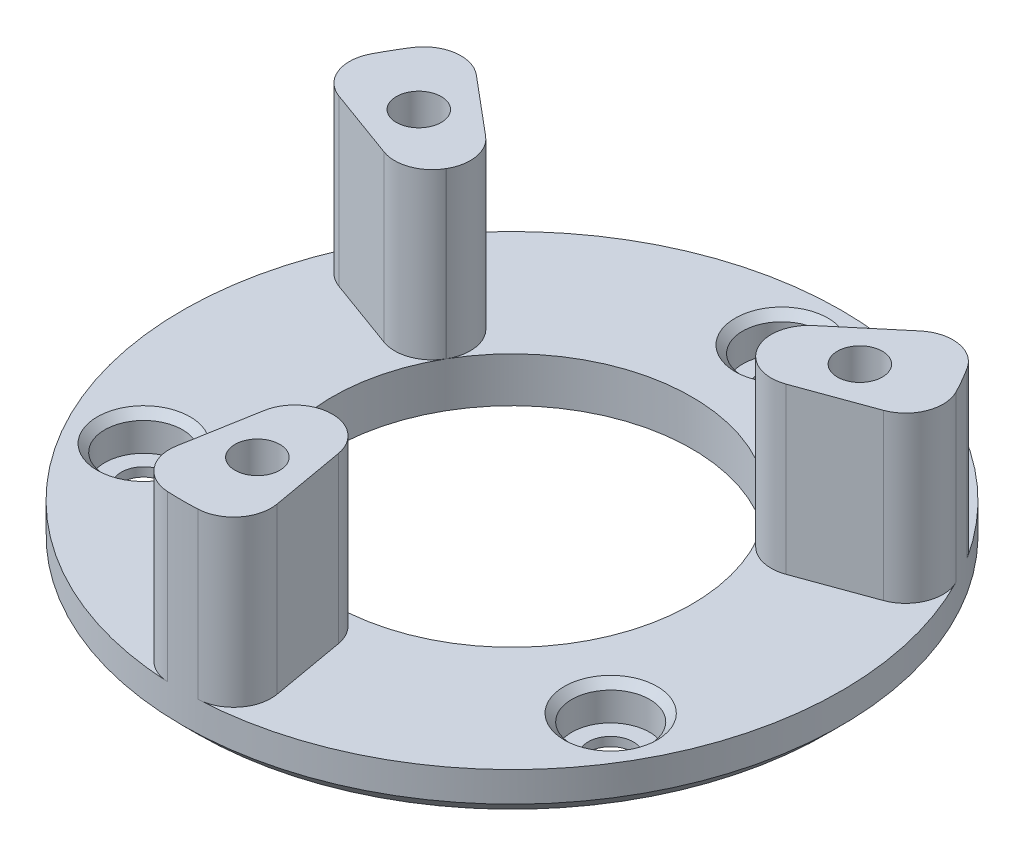
from build123d import *
from build123d.topology import SkipClean

# Parameters (mm, degrees)
SKETCH1_R           = 22
SKETCH1_R_2         = 12
BOSS_EXTRUDE1_DEPTH = 3
SKETCH3_R           = 1.5
CUT_EXTRUDE2_DEPTH  = 32.256999216
SKETCH5_R           = 2.6
CUT_EXTRUDE3_DEPTH  = 2.4
CIRPATTERN1_COUNT   = 3
SKETCH4_R           = 1.5
BOSS_EXTRUDE2_DEPTH = 11
CIRPATTERN2_COUNT   = 3
FILLET1_R           = 2.5
CHAMFER1_SIZE       = 0.5
CHAMFER2_SIZE       = 1


with BuildPart() as part:
    # Sketch1 → Boss-Extrude1 (new body)
    with BuildSketch(Plane(origin=(0, 0, 0), x_dir=(1, 0, 0), z_dir=(0, 1, 0))):
        with Locations(Location((0, 0, 0), (0, 0, 270))):
            Circle(SKETCH1_R)
        with Locations(Location((0, 0, 0), (0, 0, 270))):
            Circle(SKETCH1_R_2, mode=Mode.SUBTRACT)
    extrude(amount=BOSS_EXTRUDE1_DEPTH)

    # Sketch3 → Cut-Extrude2 (cut, through all)
    with BuildSketch(Plane(origin=(0, 3, 0), x_dir=(1, 0, 0), z_dir=(0, 1, 0))):
        with Locations(Location((14.722431864, 8.5, 0), (0, 0, 270))):
            Circle(SKETCH3_R)
        with Locations(Location((0, 18, 0), (0, 0, 270))):
            Circle(SKETCH3_R)
    cut_extrude2 = extrude(amount=-CUT_EXTRUDE2_DEPTH, mode=Mode.SUBTRACT)

    # Sketch5 → Cut-Extrude3 (cut)
    with BuildSketch(Plane(origin=(0, 3, 0), x_dir=(1, 0, 0), z_dir=(0, 1, 0))):
        with Locations(Location((0, 18, 0), (0, 0, 270))):
            Circle(SKETCH5_R)
    cut_extrude3 = extrude(amount=-CUT_EXTRUDE3_DEPTH, mode=Mode.SUBTRACT)

    # CirPattern1: Cut-Extrude2, Cut-Extrude3 ×3 about axis
    cirpattern1_axis = Axis((0, 0, 0), (0, 1, 0))
    add([cut_extrude2.rotate(cirpattern1_axis, i * 360 / CIRPATTERN1_COUNT) for i in range(1, CIRPATTERN1_COUNT)], mode=Mode.SUBTRACT)
    add([cut_extrude3.rotate(cirpattern1_axis, i * 360 / CIRPATTERN1_COUNT) for i in range(1, CIRPATTERN1_COUNT)], mode=Mode.SUBTRACT)

    # Sketch4 → Boss-Extrude2 (add)
    with SkipClean():  # the faces are left unmerged after this step: merging them gives an invalid solid
        with BuildSketch(Plane(origin=(0, 3, 0), x_dir=(1, 0, 0), z_dir=(0, 1, 0))):
            with BuildLine():
                Line((9.192533317, 7.713451316), (16.852977749, 14.141327413))
                ThreePointArc((16.852977749, 14.141327413), (19.052558883, 11), (20.673237657, 7.524443153))
                Line((20.673237657, 7.524443153), (11.276311449, 4.10424172))
                ThreePointArc((11.276311449, 4.10424172), (10.392304845, 6), (9.192533317, 7.713451316))
            make_face()
            with Locations(Location((14.722431864, 8.5, 0), (0, 0, 270))):
                Circle(SKETCH4_R, mode=Mode.SUBTRACT)
        boss_extrude2 = extrude(amount=BOSS_EXTRUDE2_DEPTH)

    # CirPattern2: Boss-Extrude2 ×3 about axis
    with SkipClean():  # the faces are left unmerged after this step: merging them gives an invalid solid
        cirpattern2_axis = Axis((0, 0, 0), (0, 1, 0))
        for i in range(1, CIRPATTERN2_COUNT):
            add(boss_extrude2.rotate(cirpattern2_axis, i * 360 / CIRPATTERN2_COUNT))

    # Fillet1
    # the kernel refuses this fillet: 2.5 mm, written as the material it takes off along each edge
    with BuildSketch(Plane(origin=(9.192533317, 3, -7.713451316), x_dir=(0.7660444431189769, 0, -0.6427876096865408), z_dir=(0, 1, 0)), Plane(origin=(-11.276311449, 3, -4.10424172), x_dir=(-0.9396926207859091, 0, -0.34202014332566705), z_dir=(0, 1, 0)), Plane(origin=(2.083778132, 3, 11.817693036), x_dir=(0.1736481776669318, 0, 0.9848077530122079), z_dir=(0, 1, 0))) as fillet1_piece_1:
        with BuildLine():
            CenterArc((2.282856857, -2.5), FILLET1_R, 90, 80.071808158)
            ThreePointArc((-0.17970467, -2.068965517), (-0.045010582, -1.03837759), (0, 0))
            Line((0, 0), (2.282856857, 0))
        make_face()
    extrude(amount=16.707142143, mode=Mode.SUBTRACT)
    with BuildSketch(Plane(origin=(11.276311449, 3, -4.10424172), x_dir=(0.9396926207859079, 0, -0.34202014332567005), z_dir=(0, 1, 0)), Plane(origin=(-9.192533317, 3, -7.713451316), x_dir=(-0.7660444431189779, 0, -0.6427876096865395), z_dir=(0, 1, 0)), Plane(origin=(-2.083778132, 3, 11.817693036), x_dir=(-0.17364817766692894, 0, 0.9848077530122082), z_dir=(0, 1, 0))) as fillet1_piece_2:
        with BuildLine():
            CenterArc((2.282856857, 2.5), FILLET1_R, 189.928191842, 80.071808158)
            ThreePointArc((-0.17970467, 2.068965517), (-0.045010582, 1.03837759), (0, 0))
            Line((0, 0), (2.282856857, 0))
        make_face()
    extrude(amount=16.707142143, mode=Mode.SUBTRACT)
    with BuildSketch(Plane(origin=(20.673237657, 3, -7.524443153), x_dir=(-0.40167516398546327, 0, -0.9157822135405619), z_dir=(0, 1, 0)), Plane(origin=(-16.852977749, 3, -14.141327413), x_dir=(-0.5922530792673408, 0, 0.8057520028509721), z_dir=(0, 1, 0)), Plane(origin=(-3.820259909, 3, 21.665770566), x_dir=(0.9939282432528036, 0, 0.11003021068958989), z_dir=(0, 1, 0))) as fillet1_piece_3:
        with BuildLine():
            CenterArc((2.66576178, 2.494836964), FILLET1_R, 176.317057086, 97.365885829)
            Line((0.170924817, 2.655425023), (0, 0))
            ThreePointArc((0, 0), (1.41317492, -0.04543472), (2.826349839, 0))
        make_face()
    extrude(amount=18.065874598, mode=Mode.SUBTRACT)
    with BuildSketch(Plane(origin=(16.852977749, 3, -14.141327413), x_dir=(0.5922530792673405, 0, 0.8057520028509723), z_dir=(0, 1, 0)), Plane(origin=(-20.673237657, 3, -7.524443153), x_dir=(0.40167516398546094, 0, -0.9157822135405629), z_dir=(0, 1, 0)), Plane(origin=(3.820259909, 3, 21.665770566), x_dir=(-0.9939282432528035, 0, 0.11003021068959112), z_dir=(0, 1, 0))) as fillet1_piece_4:
        with BuildLine():
            CenterArc((2.66576178, -2.494836964), FILLET1_R, 86.317057086, 97.365885829)
            Line((0.170924817, -2.655425023), (0, 0))
            ThreePointArc((0, 0), (1.41317492, 0.04543472), (2.826349839, 0))
        make_face()
    extrude(amount=18.065874598, mode=Mode.SUBTRACT)

    # Chamfer1
    chamfer1_edges = [part.edges().sort_by_distance(p)[0] for p in [
        (0, 3, -20.6),
        (17.840123318, 3, 10.3),
        (-17.840123318, 3, 10.3),
    ]]
    chamfer(chamfer1_edges, length=CHAMFER1_SIZE)

    # Chamfer2
    chamfer2_edges = [part.edges().sort_by_distance(p)[0] for p in [
        (0, 0, -22),
    ]]
    chamfer(chamfer2_edges, length=CHAMFER2_SIZE)


solid = part.part
